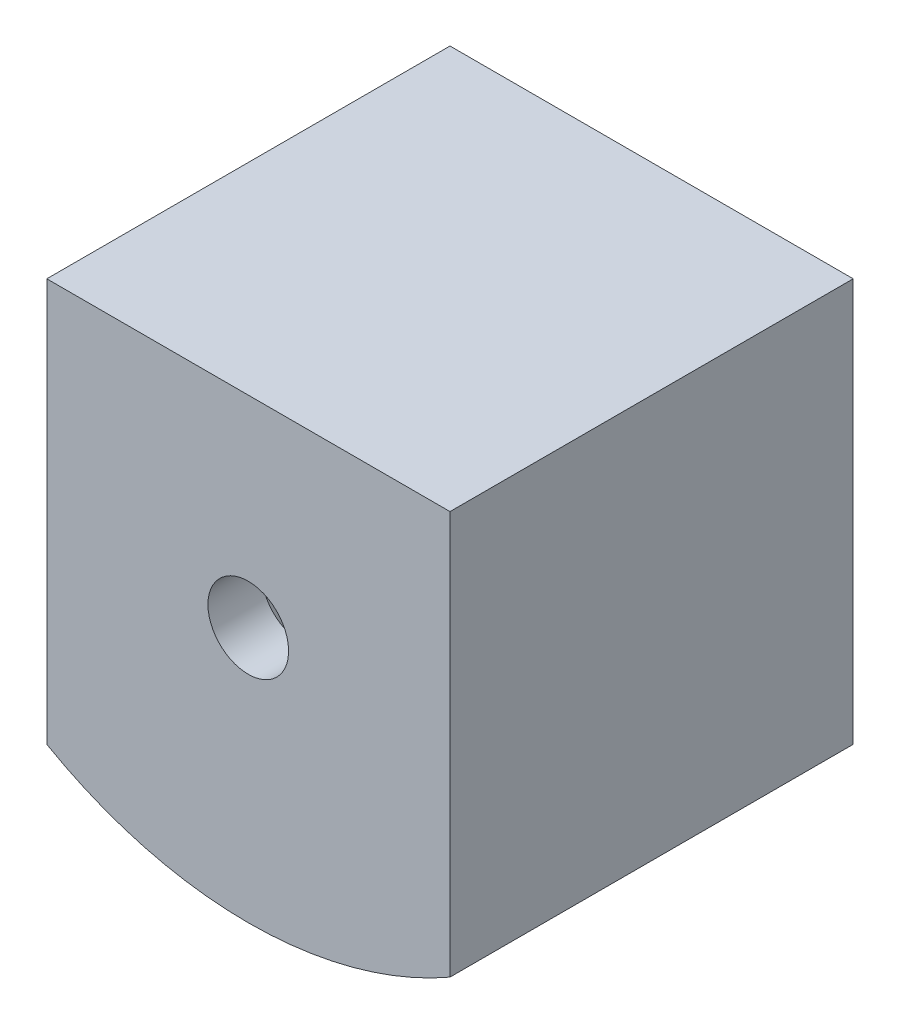
from build123d import *

# Parameters (mm, degrees)
BOSS_EXTRUDE1_DEPTH = 30
SHELL13_T           = -4
SKETCH3_R           = 3
CUT_EXTRUDE2_DEPTH  = 4
SKETCH4_W           = 3
SKETCH4_H           = 8
CUT_EXTRUDE3_DEPTH  = 27


with BuildPart() as part:
    # Sketch1 → Boss-Extrude1 (new body)
    with BuildSketch(Plane.XY):
        with BuildLine():
            Line((15, -15), (15, 15))
            Line((15, 15), (-15, 15))
            Line((-15, 15), (-15, -15))
            ThreePointArc((-15, -15), (0, -19.004680178), (15, -15))
        make_face()
    extrude(amount=BOSS_EXTRUDE1_DEPTH)

    # Shell13
    shell13_openings = [part.faces().sort_by_distance(p)[0] for p in [
        (0, -1.375060702, 0),
    ]]
    offset(amount=SHELL13_T, openings=shell13_openings, kind=Kind.INTERSECTION)

    # Sketch3 → Cut-Extrude2 (cut)
    with BuildSketch(Plane(origin=(0, 0, 26), x_dir=(-1, 0, 0), z_dir=(0, 0, -1))):
        with Locations((0.010259738, 0.007572697)):
            Circle(SKETCH3_R)
    extrude(amount=-CUT_EXTRUDE2_DEPTH, mode=Mode.SUBTRACT)

    # Sketch4 → Cut-Extrude3 (cut)
    with BuildSketch(Plane(origin=(0, 0, 0), x_dir=(-1, 0, 0), z_dir=(0, 0, -1))):
        with Locations((-13.022624284, -1.7)):
            Rectangle(SKETCH4_W, SKETCH4_H)
        with Locations((-13, 7.1)):
            Rectangle(SKETCH4_W, SKETCH4_H)
        with Locations((-13.06928273, -10.5)):
            Rectangle(SKETCH4_W, SKETCH4_H)
        Polygon((14.457482303, -14.530978405), (11.457489137, -14.524574997), (11.474564892, -6.524593221), (14.474558058, -6.530996628), align=None)
        Polygon((14.446683048, 2.269082916), (14.429607294, -5.73089886), (11.429614128, -5.724495452), (11.446689882, 2.275486324), align=None)
        Polygon((14.425766391, 3.069129385), (11.425773225, 3.075532793), (11.442848979, 11.075514569), (14.442842145, 11.069111161), align=None)
    extrude(amount=-CUT_EXTRUDE3_DEPTH, mode=Mode.SUBTRACT)


solid = part.part
